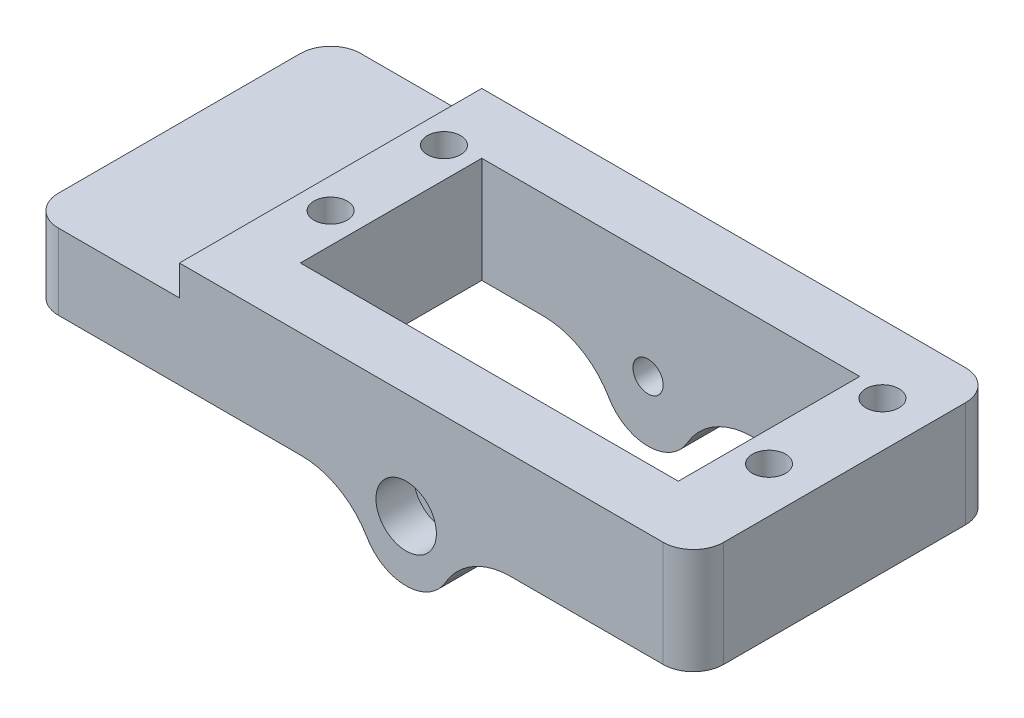
from build123d import *
from build123d.topology import SkipClean

# Parameters (mm, degrees)
SKETCH_1_W           = 50
SKETCH_1_H           = 20
EXTRUDE_1_DEPTH      = 7
EXTRUDE_2_DEPTH      = 5
SKETCH_3_R           = 1
CUT_EXTRUDE_1_DEPTH  = 33.771939216
SKETCH_5_W           = 6
SKETCH_5_H           = 20
CUT_EXTRUDE_5_DEPTH  = 30.086079144
SKETCH_6_R           = 2
CUT_EXTRUDE_6_DEPTH  = 2.5
FILLET_2_R           = 2
FILLET_3_R           = 5
SKETCH_8_R           = 1.1
CUT_EXTRUDE_9_DEPTH  = 30.086079144
SKETCH_7_W           = 25
SKETCH_7_H           = 12
CUT_EXTRUDE_7_DEPTH  = 30.086079144
SKETCH_10_R          = 3
CUT_EXTRUDE_11_DEPTH = 3
SKETCH_12_R          = 2
EXTRUDE_3_DEPTH      = 5
SKETCH_13_W          = 10
SKETCH_13_H          = 20
CUT_EXTRUDE_12_DEPTH = 2


with BuildPart() as part:
    # 草图1 → 凸台-拉伸1 (new body)
    with BuildSketch(Plane(origin=(0, 0, 0), x_dir=(1, 0, 0), z_dir=(0, 1, 0))):
        Rectangle(SKETCH_1_W, SKETCH_1_H)
    extrude(amount=EXTRUDE_1_DEPTH)

    # 草图2 → 凸台-拉伸2 (add)
    with BuildSketch(Plane.XY.offset(10)):
        with BuildLine():
            Line((-2.828427125, 0), (2.828427125, 0))
            ThreePointArc((2.828427125, 0), (0, -4), (-2.828427125, 0))
        make_face()
    extrude_2 = extrude(amount=-EXTRUDE_2_DEPTH)

    # 草图3 → 切除-拉伸1 (cut, through all)
    with BuildSketch(Plane.XY.offset(10)):
        Circle(SKETCH_3_R)
    cut_extrude_1 = extrude(amount=-CUT_EXTRUDE_1_DEPTH, mode=Mode.SUBTRACT)

    # 镜向1: 凸台-拉伸2, 切除-拉伸1 across plane
    with SkipClean():  # the faces are left unmerged after this step: merging them gives an invalid solid
        add(extrude_2.mirror(Plane.XY))
        add(cut_extrude_1.mirror(Plane.XY), mode=Mode.SUBTRACT)

    # 草图5 → 切除-拉伸5 (cut, through all)
    with SkipClean():  # the faces are left unmerged after this step: merging them gives an invalid solid
        with BuildSketch(Plane(origin=(0, 7, 0), x_dir=(1, 0, 0), z_dir=(0, 1, 0))):
            with Locations((22, 0)):
                Rectangle(SKETCH_5_W, SKETCH_5_H)
        extrude(amount=-CUT_EXTRUDE_5_DEPTH, mode=Mode.SUBTRACT)

    # 草图6 → 切除-拉伸6 (cut)
    with SkipClean():  # the faces are left unmerged after this step: merging them gives an invalid solid
        with BuildSketch(Plane.XY.offset(10)):
            Circle(SKETCH_6_R)
        extrude(amount=-CUT_EXTRUDE_6_DEPTH, mode=Mode.SUBTRACT)

    # 圆角2
    fillet_2_edges = [part.edges().sort_by_distance(p)[0] for p in [
        (-25, 3.5, -10),
        (-25, 3.5, 10),
        (19, 3.5, 10),
        (19, 3.5, -10),
    ]]
    fillet(fillet_2_edges, radius=FILLET_2_R)

    # 圆角3
    fillet_3_edges = [part.edges().sort_by_distance(p)[0] for p in [
        (-2.828427125, 0, 7.5),
        (2.828427125, 0, 7.5),
        (2.828427125, 0, -7.5),
        (-2.828427125, 0, -7.5),
    ]]
    fillet(fillet_3_edges, radius=FILLET_3_R)

    # 草图8 → 切除-拉伸9 (cut, through all)
    with SkipClean():  # the faces are left unmerged after this step: merging them gives an invalid solid
        with BuildSketch(Plane(origin=(0, 7, 0), x_dir=(1, 0, 0), z_dir=(0, 1, 0))):
            with Locations((-13, 5.5)):
                Circle(SKETCH_8_R)
            with Locations((-13, -2)):
                Circle(SKETCH_8_R)
            with Locations((16, 5.5)):
                Circle(SKETCH_8_R)
            with Locations((16, -2)):
                Circle(SKETCH_8_R)
        extrude(amount=-CUT_EXTRUDE_9_DEPTH, mode=Mode.SUBTRACT)

    # 草图7 → 切除-拉伸7 (cut, through all)
    with SkipClean():  # the faces are left unmerged after this step: merging them gives an invalid solid
        with BuildSketch(Plane(origin=(0, 7, 0), x_dir=(1, 0, 0), z_dir=(0, 1, 0))):
            with Locations((1.5, 0)):
                Rectangle(SKETCH_7_W, SKETCH_7_H)
        extrude(amount=-CUT_EXTRUDE_7_DEPTH, mode=Mode.SUBTRACT)

    # 草图10 → 切除-拉伸11 (cut)
    with SkipClean():  # the faces are left unmerged after this step: merging them gives an invalid solid
        with BuildSketch(Plane.XZ):
            with Locations((-20, 0)):
                Circle(SKETCH_10_R)
        extrude(amount=-CUT_EXTRUDE_11_DEPTH, mode=Mode.SUBTRACT)

    # 草图12 → 凸台-拉伸3 (add)
    with SkipClean():  # the faces are left unmerged after this step: merging them gives an invalid solid
        with BuildSketch(Plane.XZ.offset(-3)):
            with Locations((-20, 0)):
                Circle(SKETCH_12_R)
        extrude(amount=EXTRUDE_3_DEPTH)

    # 草图13 → 切除-拉伸12 (cut)
    with SkipClean():  # the faces are left unmerged after this step: merging them gives an invalid solid
        with BuildSketch(Plane(origin=(0, 7, 0), x_dir=(1, 0, 0), z_dir=(0, 1, 0))):
            with Locations((-20, 0)):
                Rectangle(SKETCH_13_W, SKETCH_13_H)
        extrude(amount=-CUT_EXTRUDE_12_DEPTH, mode=Mode.SUBTRACT)


solid = part.part
